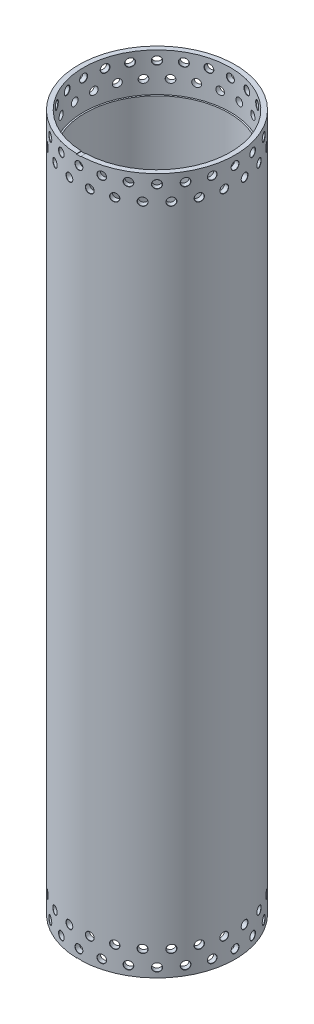
from build123d import *
from build123d.topology import SkipClean

# Parameters (mm, degrees)
SZKIC1_R                    = 90
SZKIC1_R_2                  = 80
DODANIE_WYCI_GNI_CIE1_DEPTH = 775
SZKIC2_R                    = 90
SZKIC2_R_2                  = 87
WYTNIJ_WYCI_GNI_CIE1_DEPTH  = 786.382072625
WYTNIJ_WYCI_GNI_CIE2_START  = -43
SZKIC3_R                    = 81.7
SZKIC3_R_2                  = 80
WYTNIJ_WYCI_GNI_CIE2_DEPTH  = 43
WYTNIJ_WYCI_GNI_CIE3_DEPTH  = 0.5
SZYK_KO_OWY1_COUNT          = 24


with BuildPart() as part:
    # Szkic1 → Dodanie-wyciągnięcie1 (new body)
    with BuildSketch(Plane(origin=(0, 0, 0), x_dir=(1, 0, 0), z_dir=(0, 1, 0))):
        with Locations(Location((0, 0, 0), (0, 0, 270))):
            Circle(SZKIC1_R)
        with Locations(Location((0, 0, 0), (0, 0, 270))):
            Circle(SZKIC1_R_2, mode=Mode.SUBTRACT)
    extrude(amount=DODANIE_WYCI_GNI_CIE1_DEPTH)

    # Szkic2 → Wytnij-wyciągnięcie1 (cut, through all)
    with BuildSketch(Plane(origin=(0, 775, 0), x_dir=(1, 0, 0), z_dir=(0, 1, 0))):
        Circle(SZKIC2_R)
        with Locations(Location((0, 0, 0), (0, 0, 270))):
            Circle(SZKIC2_R_2, mode=Mode.SUBTRACT)
    extrude(amount=-WYTNIJ_WYCI_GNI_CIE1_DEPTH, mode=Mode.SUBTRACT)

    # Szkic3 → Wytnij-wyciągnięcie2 (cut)
    with BuildSketch(Plane(origin=(0, 775, 0), x_dir=(1, 0, 0), z_dir=(0, 1, 0)).offset(WYTNIJ_WYCI_GNI_CIE2_START)):
        with Locations(Location((0, 0, 0), (0, 0, 270))):
            Circle(SZKIC3_R)
        with Locations(Location((0, 0, 0), (0, 0, 270))):
            Circle(SZKIC3_R_2, mode=Mode.SUBTRACT)
    wytnij_wyci_gni_cie2 = extrude(amount=WYTNIJ_WYCI_GNI_CIE2_DEPTH, mode=Mode.SUBTRACT)

    # Otwór Ø8.5 (8.5)1: read off the stored shape, not the designer's step
    # Otwór Ø8.5 (8.5)1 outline → Otwór Ø8.5 (8.5)1 (revolve, cut)
    with BuildSketch(Plane.XZ.offset(-764.8)):
        Polygon((4.25, 81.575923722), (4.500000084, 81.575923722), (4.5, 81.7), (4.25, 81.95), align=None)
        Polygon((0, 81.575923722), (4.25, 81.575923722), (4.25, 81.95), (4.25, 86.75), (4.25, 87.000000084), (0, 87.000000084), align=None)
        Polygon((4.25, 86.75), (4.500000084, 87.000000084), (4.25, 87.000000084), align=None)
    otw_r_8_5_8_5_1 = revolve(axis=Axis((0, 764.8, 0), (0, 0, 1)), mode=Mode.SUBTRACT)

    # Otwór Ø8.5 (8.5)2: read off the stored shape, not the designer's step
    # Otwór Ø8.5 (8.5)2 outline → Otwór Ø8.5 (8.5)2 (revolve, cut)
    with BuildSketch(Plane(origin=(0, 747.5, 0), x_dir=(0.9914448613738103, 0, -0.13052619222005205), z_dir=(0, -1, 0))):
        Polygon((0, 81.589323977), (4.25, 81.589323977), (4.25, 86.75), (4.500063259, 87.000063259), (0, 87.000063259), align=None)
    otw_r_8_5_8_5_2 = revolve(axis=Axis((0, 747.5, 0), (0.13052619222005205, 0, 0.9914448613738103)), mode=Mode.SUBTRACT)

    # Szkic9 → Wytnij-wyciągnięcie3 (cut)
    with BuildSketch(Plane(origin=(0, 775, 0), x_dir=(1, 0, 0), z_dir=(0, 1, 0))):
        with BuildLine():
            Line((0, -81.7), (0, -87))
            ThreePointArc((0, -87), (1.250129068, -86.991017797), (2.5, -86.964073042))
            Line((2.5, -86.964073042), (2.5, -81.661741348))
            ThreePointArc((2.5, -81.661741348), (1.250146364, -81.690434777), (0, -81.7))
        make_face()
        with BuildLine():
            ThreePointArc((-2.5, -86.964073042), (-1.250129068, -86.991017797), (0, -87))
            Line((0, -87), (0, -81.7))
            ThreePointArc((0, -81.7), (-1.250146364, -81.690434777), (-2.5, -81.661741348))
            Line((-2.5, -81.661741348), (-2.5, -86.964073042))
        make_face()
    wytnij_wyci_gni_cie3 = extrude(amount=-WYTNIJ_WYCI_GNI_CIE3_DEPTH, mode=Mode.SUBTRACT)

    # Szyk kołowy1: Otwór Ø8.5 (8.5)1, Otwór Ø8.5 (8.5)2 ×24 about axis
    with SkipClean():  # the faces are left unmerged after this step: merging them gives an invalid solid
        szyk_ko_owy1_axis = Axis((0, 0, 0), (0, 1, 0))
        add([otw_r_8_5_8_5_1.rotate(szyk_ko_owy1_axis, i * 360 / SZYK_KO_OWY1_COUNT) for i in range(1, SZYK_KO_OWY1_COUNT)], mode=Mode.SUBTRACT)
        add([otw_r_8_5_8_5_2.rotate(szyk_ko_owy1_axis, i * 360 / SZYK_KO_OWY1_COUNT) for i in range(1, SZYK_KO_OWY1_COUNT)], mode=Mode.SUBTRACT)

    # Lustro1: Wytnij-wyciągnięcie2, Otwór Ø8.5 (8.5)1, Otwór Ø8.5 (8.5)2, Wytnij-wyciągnięcie3 across plane
    with SkipClean():  # the faces are left unmerged after this step: merging them gives an invalid solid
        add(wytnij_wyci_gni_cie2.mirror(Plane.ZX.offset(387.5)), mode=Mode.SUBTRACT)
        add(otw_r_8_5_8_5_1.mirror(Plane.ZX.offset(387.5)), mode=Mode.SUBTRACT)
        add(otw_r_8_5_8_5_2.mirror(Plane.ZX.offset(387.5)), mode=Mode.SUBTRACT)
        add(wytnij_wyci_gni_cie3.mirror(Plane.ZX.offset(387.5)), mode=Mode.SUBTRACT)

    # Lustro1 copy 1 sketch → Lustro1 copy 1 (revolve, cut)
    with SkipClean():  # the faces are left unmerged after this step: merging them gives an invalid solid
        with BuildSketch(Plane(origin=(0, 10.2, 0), x_dir=(0.9659258262890683, 0, -0.25881904510252074), z_dir=(0, 1, 0))):
            Polygon((4.25, -81.575923722), (4.500000084, -81.575923722), (4.5, -81.7), (4.25, -81.95), align=None)
            Polygon((0, -81.575923722), (4.25, -81.575923722), (4.25, -81.95), (4.25, -86.75), (4.25, -87.000000084), (0, -87.000000084), align=None)
            Polygon((4.25, -86.75), (4.500000084, -87.000000084), (4.25, -87.000000084), align=None)
        revolve(axis=Axis((0, 10.2, 0), (-0.25881904510252074, 0, -0.9659258262890683)), mode=Mode.SUBTRACT)

    # Lustro1 copy 2 sketch → Lustro1 copy 2 (revolve, cut)
    with SkipClean():  # the faces are left unmerged after this step: merging them gives an invalid solid
        with BuildSketch(Plane(origin=(0, 10.2, 0), x_dir=(0.8660254037844387, 0, -0.49999999999999994), z_dir=(0, 1, 0))):
            Polygon((4.25, -81.575923722), (4.500000084, -81.575923722), (4.5, -81.7), (4.25, -81.95), align=None)
            Polygon((0, -81.575923722), (4.25, -81.575923722), (4.25, -81.95), (4.25, -86.75), (4.25, -87.000000084), (0, -87.000000084), align=None)
            Polygon((4.25, -86.75), (4.500000084, -87.000000084), (4.25, -87.000000084), align=None)
        revolve(axis=Axis((0, 10.2, 0), (-0.49999999999999994, 0, -0.8660254037844387)), mode=Mode.SUBTRACT)

    # Lustro1 copy 3 sketch → Lustro1 copy 3 (revolve, cut)
    with SkipClean():  # the faces are left unmerged after this step: merging them gives an invalid solid
        with BuildSketch(Plane(origin=(0, 10.2, 0), x_dir=(0.7071067811865476, 0, -0.7071067811865475), z_dir=(0, 1, 0))):
            Polygon((4.25, -81.575923722), (4.500000084, -81.575923722), (4.5, -81.7), (4.25, -81.95), align=None)
            Polygon((0, -81.575923722), (4.25, -81.575923722), (4.25, -81.95), (4.25, -86.75), (4.25, -87.000000084), (0, -87.000000084), align=None)
            Polygon((4.25, -86.75), (4.500000084, -87.000000084), (4.25, -87.000000084), align=None)
        revolve(axis=Axis((0, 10.2, 0), (-0.7071067811865475, 0, -0.7071067811865476)), mode=Mode.SUBTRACT)

    # Lustro1 copy 4 sketch → Lustro1 copy 4 (revolve, cut)
    with SkipClean():  # the faces are left unmerged after this step: merging them gives an invalid solid
        with BuildSketch(Plane(origin=(0, 10.2, 0), x_dir=(0.5000000000000001, 0, -0.8660254037844386), z_dir=(0, 1, 0))):
            Polygon((4.25, -81.575923722), (4.500000084, -81.575923722), (4.5, -81.7), (4.25, -81.95), align=None)
            Polygon((0, -81.575923722), (4.25, -81.575923722), (4.25, -81.95), (4.25, -86.75), (4.25, -87.000000084), (0, -87.000000084), align=None)
            Polygon((4.25, -86.75), (4.500000084, -87.000000084), (4.25, -87.000000084), align=None)
        revolve(axis=Axis((0, 10.2, 0), (-0.8660254037844386, 0, -0.5000000000000001)), mode=Mode.SUBTRACT)

    # Lustro1 copy 5 sketch → Lustro1 copy 5 (revolve, cut)
    with SkipClean():  # the faces are left unmerged after this step: merging them gives an invalid solid
        with BuildSketch(Plane(origin=(0, 10.2, 0), x_dir=(0.25881904510252074, 0, -0.9659258262890683), z_dir=(0, 1, 0))):
            Polygon((4.25, -81.575923722), (4.500000084, -81.575923722), (4.5, -81.7), (4.25, -81.95), align=None)
            Polygon((0, -81.575923722), (4.25, -81.575923722), (4.25, -81.95), (4.25, -86.75), (4.25, -87.000000084), (0, -87.000000084), align=None)
            Polygon((4.25, -86.75), (4.500000084, -87.000000084), (4.25, -87.000000084), align=None)
        revolve(axis=Axis((0, 10.2, 0), (-0.9659258262890683, 0, -0.25881904510252074)), mode=Mode.SUBTRACT)

    # Lustro1 copy 6 sketch → Lustro1 copy 6 (revolve, cut)
    with SkipClean():  # the faces are left unmerged after this step: merging them gives an invalid solid
        with BuildSketch(Plane(origin=(0, 10.2, 0), x_dir=(0, 0, -1), z_dir=(0, 1, 0))):
            Polygon((4.25, -81.575923722), (4.500000084, -81.575923722), (4.5, -81.7), (4.25, -81.95), align=None)
            Polygon((0, -81.575923722), (4.25, -81.575923722), (4.25, -81.95), (4.25, -86.75), (4.25, -87.000000084), (0, -87.000000084), align=None)
            Polygon((4.25, -86.75), (4.500000084, -87.000000084), (4.25, -87.000000084), align=None)
        revolve(axis=Axis((0, 10.2, 0), (-1, 0, 0)), mode=Mode.SUBTRACT)

    # Lustro1 copy 7 sketch → Lustro1 copy 7 (revolve, cut)
    with SkipClean():  # the faces are left unmerged after this step: merging them gives an invalid solid
        with BuildSketch(Plane(origin=(0, 10.2, 0), x_dir=(-0.25881904510252085, 0, -0.9659258262890683), z_dir=(0, 1, 0))):
            Polygon((4.25, -81.575923722), (4.500000084, -81.575923722), (4.5, -81.7), (4.25, -81.95), align=None)
            Polygon((0, -81.575923722), (4.25, -81.575923722), (4.25, -81.95), (4.25, -86.75), (4.25, -87.000000084), (0, -87.000000084), align=None)
            Polygon((4.25, -86.75), (4.500000084, -87.000000084), (4.25, -87.000000084), align=None)
        revolve(axis=Axis((0, 10.2, 0), (-0.9659258262890683, 0, 0.25881904510252085)), mode=Mode.SUBTRACT)

    # Lustro1 copy 8 sketch → Lustro1 copy 8 (revolve, cut)
    with SkipClean():  # the faces are left unmerged after this step: merging them gives an invalid solid
        with BuildSketch(Plane(origin=(0, 10.2, 0), x_dir=(-0.4999999999999998, 0, -0.8660254037844387), z_dir=(0, 1, 0))):
            Polygon((4.25, -81.575923722), (4.500000084, -81.575923722), (4.5, -81.7), (4.25, -81.95), align=None)
            Polygon((0, -81.575923722), (4.25, -81.575923722), (4.25, -81.95), (4.25, -86.75), (4.25, -87.000000084), (0, -87.000000084), align=None)
            Polygon((4.25, -86.75), (4.500000084, -87.000000084), (4.25, -87.000000084), align=None)
        revolve(axis=Axis((0, 10.2, 0), (-0.8660254037844387, 0, 0.4999999999999998)), mode=Mode.SUBTRACT)

    # Lustro1 copy 9 sketch → Lustro1 copy 9 (revolve, cut)
    with SkipClean():  # the faces are left unmerged after this step: merging them gives an invalid solid
        with BuildSketch(Plane(origin=(0, 10.2, 0), x_dir=(-0.7071067811865475, 0, -0.7071067811865476), z_dir=(0, 1, 0))):
            Polygon((4.25, -81.575923722), (4.500000084, -81.575923722), (4.5, -81.7), (4.25, -81.95), align=None)
            Polygon((0, -81.575923722), (4.25, -81.575923722), (4.25, -81.95), (4.25, -86.75), (4.25, -87.000000084), (0, -87.000000084), align=None)
            Polygon((4.25, -86.75), (4.500000084, -87.000000084), (4.25, -87.000000084), align=None)
        revolve(axis=Axis((0, 10.2, 0), (-0.7071067811865476, 0, 0.7071067811865475)), mode=Mode.SUBTRACT)

    # Lustro1 copy 10 sketch → Lustro1 copy 10 (revolve, cut)
    with SkipClean():  # the faces are left unmerged after this step: merging them gives an invalid solid
        with BuildSketch(Plane(origin=(0, 10.2, 0), x_dir=(-0.8660254037844387, 0, -0.49999999999999994), z_dir=(0, 1, 0))):
            Polygon((4.25, -81.575923722), (4.500000084, -81.575923722), (4.5, -81.7), (4.25, -81.95), align=None)
            Polygon((0, -81.575923722), (4.25, -81.575923722), (4.25, -81.95), (4.25, -86.75), (4.25, -87.000000084), (0, -87.000000084), align=None)
            Polygon((4.25, -86.75), (4.500000084, -87.000000084), (4.25, -87.000000084), align=None)
        revolve(axis=Axis((0, 10.2, 0), (-0.49999999999999994, 0, 0.8660254037844387)), mode=Mode.SUBTRACT)

    # Lustro1 copy 11 sketch → Lustro1 copy 11 (revolve, cut)
    with SkipClean():  # the faces are left unmerged after this step: merging them gives an invalid solid
        with BuildSketch(Plane(origin=(0, 10.2, 0), x_dir=(-0.9659258262890682, 0, -0.258819045102521), z_dir=(0, 1, 0))):
            Polygon((4.25, -81.575923722), (4.500000084, -81.575923722), (4.5, -81.7), (4.25, -81.95), align=None)
            Polygon((0, -81.575923722), (4.25, -81.575923722), (4.25, -81.95), (4.25, -86.75), (4.25, -87.000000084), (0, -87.000000084), align=None)
            Polygon((4.25, -86.75), (4.500000084, -87.000000084), (4.25, -87.000000084), align=None)
        revolve(axis=Axis((0, 10.2, 0), (-0.258819045102521, 0, 0.9659258262890682)), mode=Mode.SUBTRACT)

    # Lustro1 copy 12 sketch → Lustro1 copy 12 (revolve, cut)
    with SkipClean():  # the faces are left unmerged after this step: merging them gives an invalid solid
        with BuildSketch(Plane(origin=(0, 10.2, 0), x_dir=(-1, 0, 0), z_dir=(0, 1, 0))):
            Polygon((4.25, -81.575923722), (4.500000084, -81.575923722), (4.5, -81.7), (4.25, -81.95), align=None)
            Polygon((0, -81.575923722), (4.25, -81.575923722), (4.25, -81.95), (4.25, -86.75), (4.25, -87.000000084), (0, -87.000000084), align=None)
            Polygon((4.25, -86.75), (4.500000084, -87.000000084), (4.25, -87.000000084), align=None)
        revolve(axis=Axis((0, 10.2, 0), (0, 0, 1)), mode=Mode.SUBTRACT)

    # Lustro1 copy 13 sketch → Lustro1 copy 13 (revolve, cut)
    with SkipClean():  # the faces are left unmerged after this step: merging them gives an invalid solid
        with BuildSketch(Plane(origin=(0, 10.2, 0), x_dir=(-0.9659258262890683, 0, 0.2588190451025208), z_dir=(0, 1, 0))):
            Polygon((4.25, -81.575923722), (4.500000084, -81.575923722), (4.5, -81.7), (4.25, -81.95), align=None)
            Polygon((0, -81.575923722), (4.25, -81.575923722), (4.25, -81.95), (4.25, -86.75), (4.25, -87.000000084), (0, -87.000000084), align=None)
            Polygon((4.25, -86.75), (4.500000084, -87.000000084), (4.25, -87.000000084), align=None)
        revolve(axis=Axis((0, 10.2, 0), (0.2588190451025208, 0, 0.9659258262890683)), mode=Mode.SUBTRACT)

    # Lustro1 copy 14 sketch → Lustro1 copy 14 (revolve, cut)
    with SkipClean():  # the faces are left unmerged after this step: merging them gives an invalid solid
        with BuildSketch(Plane(origin=(0, 10.2, 0), x_dir=(-0.8660254037844386, 0, 0.5000000000000001), z_dir=(0, 1, 0))):
            Polygon((4.25, -81.575923722), (4.500000084, -81.575923722), (4.5, -81.7), (4.25, -81.95), align=None)
            Polygon((0, -81.575923722), (4.25, -81.575923722), (4.25, -81.95), (4.25, -86.75), (4.25, -87.000000084), (0, -87.000000084), align=None)
            Polygon((4.25, -86.75), (4.500000084, -87.000000084), (4.25, -87.000000084), align=None)
        revolve(axis=Axis((0, 10.2, 0), (0.5000000000000001, 0, 0.8660254037844386)), mode=Mode.SUBTRACT)

    # Lustro1 copy 15 sketch → Lustro1 copy 15 (revolve, cut)
    with SkipClean():  # the faces are left unmerged after this step: merging them gives an invalid solid
        with BuildSketch(Plane(origin=(0, 10.2, 0), x_dir=(-0.7071067811865477, 0, 0.7071067811865475), z_dir=(0, 1, 0))):
            Polygon((4.25, -81.575923722), (4.500000084, -81.575923722), (4.5, -81.7), (4.25, -81.95), align=None)
            Polygon((0, -81.575923722), (4.25, -81.575923722), (4.25, -81.95), (4.25, -86.75), (4.25, -87.000000084), (0, -87.000000084), align=None)
            Polygon((4.25, -86.75), (4.500000084, -87.000000084), (4.25, -87.000000084), align=None)
        revolve(axis=Axis((0, 10.2, 0), (0.7071067811865475, 0, 0.7071067811865477)), mode=Mode.SUBTRACT)

    # Lustro1 copy 16 sketch → Lustro1 copy 16 (revolve, cut)
    with SkipClean():  # the faces are left unmerged after this step: merging them gives an invalid solid
        with BuildSketch(Plane(origin=(0, 10.2, 0), x_dir=(-0.5000000000000004, 0, 0.8660254037844384), z_dir=(0, 1, 0))):
            Polygon((4.25, -81.575923722), (4.500000084, -81.575923722), (4.5, -81.7), (4.25, -81.95), align=None)
            Polygon((0, -81.575923722), (4.25, -81.575923722), (4.25, -81.95), (4.25, -86.75), (4.25, -87.000000084), (0, -87.000000084), align=None)
            Polygon((4.25, -86.75), (4.500000084, -87.000000084), (4.25, -87.000000084), align=None)
        revolve(axis=Axis((0, 10.2, 0), (0.8660254037844384, 0, 0.5000000000000004)), mode=Mode.SUBTRACT)

    # Lustro1 copy 17 sketch → Lustro1 copy 17 (revolve, cut)
    with SkipClean():  # the faces are left unmerged after this step: merging them gives an invalid solid
        with BuildSketch(Plane(origin=(0, 10.2, 0), x_dir=(-0.25881904510252063, 0, 0.9659258262890683), z_dir=(0, 1, 0))):
            Polygon((4.25, -81.575923722), (4.500000084, -81.575923722), (4.5, -81.7), (4.25, -81.95), align=None)
            Polygon((0, -81.575923722), (4.25, -81.575923722), (4.25, -81.95), (4.25, -86.75), (4.25, -87.000000084), (0, -87.000000084), align=None)
            Polygon((4.25, -86.75), (4.500000084, -87.000000084), (4.25, -87.000000084), align=None)
        revolve(axis=Axis((0, 10.2, 0), (0.9659258262890683, 0, 0.25881904510252063)), mode=Mode.SUBTRACT)

    # Lustro1 copy 18 sketch → Lustro1 copy 18 (revolve, cut)
    with SkipClean():  # the faces are left unmerged after this step: merging them gives an invalid solid
        with BuildSketch(Plane.ZX.offset(10.2)):
            Polygon((4.25, -81.575923722), (4.500000084, -81.575923722), (4.5, -81.7), (4.25, -81.95), align=None)
            Polygon((0, -81.575923722), (4.25, -81.575923722), (4.25, -81.95), (4.25, -86.75), (4.25, -87.000000084), (0, -87.000000084), align=None)
            Polygon((4.25, -86.75), (4.500000084, -87.000000084), (4.25, -87.000000084), align=None)
        revolve(axis=Axis((0, 10.2, 0), (1, 0, 0)), mode=Mode.SUBTRACT)

    # Lustro1 copy 19 sketch → Lustro1 copy 19 (revolve, cut)
    with SkipClean():  # the faces are left unmerged after this step: merging them gives an invalid solid
        with BuildSketch(Plane(origin=(0, 10.2, 0), x_dir=(0.2588190451025203, 0, 0.9659258262890684), z_dir=(0, 1, 0))):
            Polygon((4.25, -81.575923722), (4.500000084, -81.575923722), (4.5, -81.7), (4.25, -81.95), align=None)
            Polygon((0, -81.575923722), (4.25, -81.575923722), (4.25, -81.95), (4.25, -86.75), (4.25, -87.000000084), (0, -87.000000084), align=None)
            Polygon((4.25, -86.75), (4.500000084, -87.000000084), (4.25, -87.000000084), align=None)
        revolve(axis=Axis((0, 10.2, 0), (0.9659258262890684, 0, -0.2588190451025203)), mode=Mode.SUBTRACT)

    # Lustro1 copy 20 sketch → Lustro1 copy 20 (revolve, cut)
    with SkipClean():  # the faces are left unmerged after this step: merging them gives an invalid solid
        with BuildSketch(Plane(origin=(0, 10.2, 0), x_dir=(0.5000000000000001, 0, 0.8660254037844386), z_dir=(0, 1, 0))):
            Polygon((4.25, -81.575923722), (4.500000084, -81.575923722), (4.5, -81.7), (4.25, -81.95), align=None)
            Polygon((0, -81.575923722), (4.25, -81.575923722), (4.25, -81.95), (4.25, -86.75), (4.25, -87.000000084), (0, -87.000000084), align=None)
            Polygon((4.25, -86.75), (4.500000084, -87.000000084), (4.25, -87.000000084), align=None)
        revolve(axis=Axis((0, 10.2, 0), (0.8660254037844386, 0, -0.5000000000000001)), mode=Mode.SUBTRACT)

    # Lustro1 copy 21 sketch → Lustro1 copy 21 (revolve, cut)
    with SkipClean():  # the faces are left unmerged after this step: merging them gives an invalid solid
        with BuildSketch(Plane(origin=(0, 10.2, 0), x_dir=(0.7071067811865474, 0, 0.7071067811865477), z_dir=(0, 1, 0))):
            Polygon((4.25, -81.575923722), (4.500000084, -81.575923722), (4.5, -81.7), (4.25, -81.95), align=None)
            Polygon((0, -81.575923722), (4.25, -81.575923722), (4.25, -81.95), (4.25, -86.75), (4.25, -87.000000084), (0, -87.000000084), align=None)
            Polygon((4.25, -86.75), (4.500000084, -87.000000084), (4.25, -87.000000084), align=None)
        revolve(axis=Axis((0, 10.2, 0), (0.7071067811865477, 0, -0.7071067811865474)), mode=Mode.SUBTRACT)

    # Lustro1 copy 22 sketch → Lustro1 copy 22 (revolve, cut)
    with SkipClean():  # the faces are left unmerged after this step: merging them gives an invalid solid
        with BuildSketch(Plane(origin=(0, 10.2, 0), x_dir=(0.8660254037844384, 0, 0.5000000000000004), z_dir=(0, 1, 0))):
            Polygon((4.25, -81.575923722), (4.500000084, -81.575923722), (4.5, -81.7), (4.25, -81.95), align=None)
            Polygon((0, -81.575923722), (4.25, -81.575923722), (4.25, -81.95), (4.25, -86.75), (4.25, -87.000000084), (0, -87.000000084), align=None)
            Polygon((4.25, -86.75), (4.500000084, -87.000000084), (4.25, -87.000000084), align=None)
        revolve(axis=Axis((0, 10.2, 0), (0.5000000000000004, 0, -0.8660254037844384)), mode=Mode.SUBTRACT)

    # Lustro1 copy 23 sketch → Lustro1 copy 23 (revolve, cut)
    with SkipClean():  # the faces are left unmerged after this step: merging them gives an invalid solid
        with BuildSketch(Plane(origin=(0, 10.2, 0), x_dir=(0.9659258262890683, 0, 0.2588190451025207), z_dir=(0, 1, 0))):
            Polygon((4.25, -81.575923722), (4.500000084, -81.575923722), (4.5, -81.7), (4.25, -81.95), align=None)
            Polygon((0, -81.575923722), (4.25, -81.575923722), (4.25, -81.95), (4.25, -86.75), (4.25, -87.000000084), (0, -87.000000084), align=None)
            Polygon((4.25, -86.75), (4.500000084, -87.000000084), (4.25, -87.000000084), align=None)
        revolve(axis=Axis((0, 10.2, 0), (0.2588190451025207, 0, -0.9659258262890683)), mode=Mode.SUBTRACT)

    # Lustro1 copy 24 sketch → Lustro1 copy 24 (revolve, cut)
    with SkipClean():  # the faces are left unmerged after this step: merging them gives an invalid solid
        with BuildSketch(Plane(origin=(0, 27.5, 0), x_dir=(0.9238795325112865, 0, -0.38268343236509017), z_dir=(0, 1, 0))):
            Polygon((0, -81.589323977), (4.25, -81.589323977), (4.25, -86.75), (4.500063259, -87.000063259), (0, -87.000063259), align=None)
        revolve(axis=Axis((0, 27.5, 0), (-0.38268343236509017, 0, -0.9238795325112865)), mode=Mode.SUBTRACT)

    # Lustro1 copy 25 sketch → Lustro1 copy 25 (revolve, cut)
    with SkipClean():  # the faces are left unmerged after this step: merging them gives an invalid solid
        with BuildSketch(Plane(origin=(0, 27.5, 0), x_dir=(0.7933533402912349, 0, -0.6087614290087209), z_dir=(0, 1, 0))):
            Polygon((0, -81.589323977), (4.25, -81.589323977), (4.25, -86.75), (4.500063259, -87.000063259), (0, -87.000063259), align=None)
        revolve(axis=Axis((0, 27.5, 0), (-0.6087614290087209, 0, -0.7933533402912349)), mode=Mode.SUBTRACT)

    # Lustro1 copy 26 sketch → Lustro1 copy 26 (revolve, cut)
    with SkipClean():  # the faces are left unmerged after this step: merging them gives an invalid solid
        with BuildSketch(Plane(origin=(0, 27.5, 0), x_dir=(0.6087614290087202, 0, -0.7933533402912353), z_dir=(0, 1, 0))):
            Polygon((0, -81.589323977), (4.25, -81.589323977), (4.25, -86.75), (4.500063259, -87.000063259), (0, -87.000063259), align=None)
        revolve(axis=Axis((0, 27.5, 0), (-0.7933533402912353, 0, -0.6087614290087202)), mode=Mode.SUBTRACT)

    # Lustro1 copy 27 sketch → Lustro1 copy 27 (revolve, cut)
    with SkipClean():  # the faces are left unmerged after this step: merging them gives an invalid solid
        with BuildSketch(Plane(origin=(0, 27.5, 0), x_dir=(0.3826834323650894, 0, -0.9238795325112868), z_dir=(0, 1, 0))):
            Polygon((0, -81.589323977), (4.25, -81.589323977), (4.25, -86.75), (4.500063259, -87.000063259), (0, -87.000063259), align=None)
        revolve(axis=Axis((0, 27.5, 0), (-0.9238795325112868, 0, -0.3826834323650894)), mode=Mode.SUBTRACT)

    # Lustro1 copy 28 sketch → Lustro1 copy 28 (revolve, cut)
    with SkipClean():  # the faces are left unmerged after this step: merging them gives an invalid solid
        with BuildSketch(Plane(origin=(0, 27.5, 0), x_dir=(0.13052619222005113, 0, -0.9914448613738105), z_dir=(0, 1, 0))):
            Polygon((0, -81.589323977), (4.25, -81.589323977), (4.25, -86.75), (4.500063259, -87.000063259), (0, -87.000063259), align=None)
        revolve(axis=Axis((0, 27.5, 0), (-0.9914448613738105, 0, -0.13052619222005113)), mode=Mode.SUBTRACT)

    # Lustro1 copy 29 sketch → Lustro1 copy 29 (revolve, cut)
    with SkipClean():  # the faces are left unmerged after this step: merging them gives an invalid solid
        with BuildSketch(Plane(origin=(0, 27.5, 0), x_dir=(-0.130526192220052, 0, -0.9914448613738103), z_dir=(0, 1, 0))):
            Polygon((0, -81.589323977), (4.25, -81.589323977), (4.25, -86.75), (4.500063259, -87.000063259), (0, -87.000063259), align=None)
        revolve(axis=Axis((0, 27.5, 0), (-0.9914448613738103, 0, 0.130526192220052)), mode=Mode.SUBTRACT)

    # Lustro1 copy 30 sketch → Lustro1 copy 30 (revolve, cut)
    with SkipClean():  # the faces are left unmerged after this step: merging them gives an invalid solid
        with BuildSketch(Plane(origin=(0, 27.5, 0), x_dir=(-0.3826834323650902, 0, -0.9238795325112865), z_dir=(0, 1, 0))):
            Polygon((0, -81.589323977), (4.25, -81.589323977), (4.25, -86.75), (4.500063259, -87.000063259), (0, -87.000063259), align=None)
        revolve(axis=Axis((0, 27.5, 0), (-0.9238795325112865, 0, 0.3826834323650902)), mode=Mode.SUBTRACT)

    # Lustro1 copy 31 sketch → Lustro1 copy 31 (revolve, cut)
    with SkipClean():  # the faces are left unmerged after this step: merging them gives an invalid solid
        with BuildSketch(Plane(origin=(0, 27.5, 0), x_dir=(-0.6087614290087208, 0, -0.7933533402912349), z_dir=(0, 1, 0))):
            Polygon((0, -81.589323977), (4.25, -81.589323977), (4.25, -86.75), (4.500063259, -87.000063259), (0, -87.000063259), align=None)
        revolve(axis=Axis((0, 27.5, 0), (-0.7933533402912349, 0, 0.6087614290087208)), mode=Mode.SUBTRACT)

    # Lustro1 copy 32 sketch → Lustro1 copy 32 (revolve, cut)
    with SkipClean():  # the faces are left unmerged after this step: merging them gives an invalid solid
        with BuildSketch(Plane(origin=(0, 27.5, 0), x_dir=(-0.7933533402912353, 0, -0.6087614290087202), z_dir=(0, 1, 0))):
            Polygon((0, -81.589323977), (4.25, -81.589323977), (4.25, -86.75), (4.500063259, -87.000063259), (0, -87.000063259), align=None)
        revolve(axis=Axis((0, 27.5, 0), (-0.6087614290087202, 0, 0.7933533402912353)), mode=Mode.SUBTRACT)

    # Lustro1 copy 33 sketch → Lustro1 copy 33 (revolve, cut)
    with SkipClean():  # the faces are left unmerged after this step: merging them gives an invalid solid
        with BuildSketch(Plane(origin=(0, 27.5, 0), x_dir=(-0.923879532511287, 0, -0.3826834323650892), z_dir=(0, 1, 0))):
            Polygon((0, -81.589323977), (4.25, -81.589323977), (4.25, -86.75), (4.500063259, -87.000063259), (0, -87.000063259), align=None)
        revolve(axis=Axis((0, 27.5, 0), (-0.3826834323650892, 0, 0.923879532511287)), mode=Mode.SUBTRACT)

    # Lustro1 copy 34 sketch → Lustro1 copy 34 (revolve, cut)
    with SkipClean():  # the faces are left unmerged after this step: merging them gives an invalid solid
        with BuildSketch(Plane(origin=(0, 27.5, 0), x_dir=(-0.9914448613738104, 0, -0.13052619222005135), z_dir=(0, 1, 0))):
            Polygon((0, -81.589323977), (4.25, -81.589323977), (4.25, -86.75), (4.500063259, -87.000063259), (0, -87.000063259), align=None)
        revolve(axis=Axis((0, 27.5, 0), (-0.13052619222005135, 0, 0.9914448613738104)), mode=Mode.SUBTRACT)

    # Lustro1 copy 35 sketch → Lustro1 copy 35 (revolve, cut)
    with SkipClean():  # the faces are left unmerged after this step: merging them gives an invalid solid
        with BuildSketch(Plane(origin=(0, 27.5, 0), x_dir=(-0.9914448613738103, 0, 0.13052619222005193), z_dir=(0, 1, 0))):
            Polygon((0, -81.589323977), (4.25, -81.589323977), (4.25, -86.75), (4.500063259, -87.000063259), (0, -87.000063259), align=None)
        revolve(axis=Axis((0, 27.5, 0), (0.13052619222005193, 0, 0.9914448613738103)), mode=Mode.SUBTRACT)

    # Lustro1 copy 36 sketch → Lustro1 copy 36 (revolve, cut)
    with SkipClean():  # the faces are left unmerged after this step: merging them gives an invalid solid
        with BuildSketch(Plane(origin=(0, 27.5, 0), x_dir=(-0.9238795325112865, 0, 0.3826834323650902), z_dir=(0, 1, 0))):
            Polygon((0, -81.589323977), (4.25, -81.589323977), (4.25, -86.75), (4.500063259, -87.000063259), (0, -87.000063259), align=None)
        revolve(axis=Axis((0, 27.5, 0), (0.3826834323650902, 0, 0.9238795325112865)), mode=Mode.SUBTRACT)

    # Lustro1 copy 37 sketch → Lustro1 copy 37 (revolve, cut)
    with SkipClean():  # the faces are left unmerged after this step: merging them gives an invalid solid
        with BuildSketch(Plane(origin=(0, 27.5, 0), x_dir=(-0.7933533402912348, 0, 0.6087614290087211), z_dir=(0, 1, 0))):
            Polygon((0, -81.589323977), (4.25, -81.589323977), (4.25, -86.75), (4.500063259, -87.000063259), (0, -87.000063259), align=None)
        revolve(axis=Axis((0, 27.5, 0), (0.6087614290087211, 0, 0.7933533402912348)), mode=Mode.SUBTRACT)

    # Lustro1 copy 38 sketch → Lustro1 copy 38 (revolve, cut)
    with SkipClean():  # the faces are left unmerged after this step: merging them gives an invalid solid
        with BuildSketch(Plane(origin=(0, 27.5, 0), x_dir=(-0.6087614290087203, 0, 0.7933533402912353), z_dir=(0, 1, 0))):
            Polygon((0, -81.589323977), (4.25, -81.589323977), (4.25, -86.75), (4.500063259, -87.000063259), (0, -87.000063259), align=None)
        revolve(axis=Axis((0, 27.5, 0), (0.7933533402912353, 0, 0.6087614290087203)), mode=Mode.SUBTRACT)

    # Lustro1 copy 39 sketch → Lustro1 copy 39 (revolve, cut)
    with SkipClean():  # the faces are left unmerged after this step: merging them gives an invalid solid
        with BuildSketch(Plane(origin=(0, 27.5, 0), x_dir=(-0.3826834323650898, 0, 0.9238795325112867), z_dir=(0, 1, 0))):
            Polygon((0, -81.589323977), (4.25, -81.589323977), (4.25, -86.75), (4.500063259, -87.000063259), (0, -87.000063259), align=None)
        revolve(axis=Axis((0, 27.5, 0), (0.9238795325112867, 0, 0.3826834323650898)), mode=Mode.SUBTRACT)

    # Lustro1 copy 40 sketch → Lustro1 copy 40 (revolve, cut)
    with SkipClean():  # the faces are left unmerged after this step: merging them gives an invalid solid
        with BuildSketch(Plane(origin=(0, 27.5, 0), x_dir=(-0.13052619222005102, 0, 0.9914448613738104), z_dir=(0, 1, 0))):
            Polygon((0, -81.589323977), (4.25, -81.589323977), (4.25, -86.75), (4.500063259, -87.000063259), (0, -87.000063259), align=None)
        revolve(axis=Axis((0, 27.5, 0), (0.9914448613738104, 0, 0.13052619222005102)), mode=Mode.SUBTRACT)

    # Lustro1 copy 41 sketch → Lustro1 copy 41 (revolve, cut)
    with SkipClean():  # the faces are left unmerged after this step: merging them gives an invalid solid
        with BuildSketch(Plane(origin=(0, 27.5, 0), x_dir=(0.13052619222005185, 0, 0.9914448613738103), z_dir=(0, 1, 0))):
            Polygon((0, -81.589323977), (4.25, -81.589323977), (4.25, -86.75), (4.500063259, -87.000063259), (0, -87.000063259), align=None)
        revolve(axis=Axis((0, 27.5, 0), (0.9914448613738103, 0, -0.13052619222005185)), mode=Mode.SUBTRACT)

    # Lustro1 copy 42 sketch → Lustro1 copy 42 (revolve, cut)
    with SkipClean():  # the faces are left unmerged after this step: merging them gives an invalid solid
        with BuildSketch(Plane(origin=(0, 27.5, 0), x_dir=(0.3826834323650897, 0, 0.9238795325112867), z_dir=(0, 1, 0))):
            Polygon((0, -81.589323977), (4.25, -81.589323977), (4.25, -86.75), (4.500063259, -87.000063259), (0, -87.000063259), align=None)
        revolve(axis=Axis((0, 27.5, 0), (0.9238795325112867, 0, -0.3826834323650897)), mode=Mode.SUBTRACT)

    # Lustro1 copy 43 sketch → Lustro1 copy 43 (revolve, cut)
    with SkipClean():  # the faces are left unmerged after this step: merging them gives an invalid solid
        with BuildSketch(Plane(origin=(0, 27.5, 0), x_dir=(0.6087614290087211, 0, 0.7933533402912348), z_dir=(0, 1, 0))):
            Polygon((0, -81.589323977), (4.25, -81.589323977), (4.25, -86.75), (4.500063259, -87.000063259), (0, -87.000063259), align=None)
        revolve(axis=Axis((0, 27.5, 0), (0.7933533402912348, 0, -0.6087614290087211)), mode=Mode.SUBTRACT)

    # Lustro1 copy 44 sketch → Lustro1 copy 44 (revolve, cut)
    with SkipClean():  # the faces are left unmerged after this step: merging them gives an invalid solid
        with BuildSketch(Plane(origin=(0, 27.5, 0), x_dir=(0.7933533402912352, 0, 0.6087614290087203), z_dir=(0, 1, 0))):
            Polygon((0, -81.589323977), (4.25, -81.589323977), (4.25, -86.75), (4.500063259, -87.000063259), (0, -87.000063259), align=None)
        revolve(axis=Axis((0, 27.5, 0), (0.6087614290087203, 0, -0.7933533402912352)), mode=Mode.SUBTRACT)

    # Lustro1 copy 45 sketch → Lustro1 copy 45 (revolve, cut)
    with SkipClean():  # the faces are left unmerged after this step: merging them gives an invalid solid
        with BuildSketch(Plane(origin=(0, 27.5, 0), x_dir=(0.9238795325112867, 0, 0.3826834323650898), z_dir=(0, 1, 0))):
            Polygon((0, -81.589323977), (4.25, -81.589323977), (4.25, -86.75), (4.500063259, -87.000063259), (0, -87.000063259), align=None)
        revolve(axis=Axis((0, 27.5, 0), (0.3826834323650898, 0, -0.9238795325112867)), mode=Mode.SUBTRACT)

    # Lustro1 copy 46 sketch → Lustro1 copy 46 (revolve, cut)
    with SkipClean():  # the faces are left unmerged after this step: merging them gives an invalid solid
        with BuildSketch(Plane(origin=(0, 27.5, 0), x_dir=(0.9914448613738105, 0, 0.13052619222005107), z_dir=(0, 1, 0))):
            Polygon((0, -81.589323977), (4.25, -81.589323977), (4.25, -86.75), (4.500063259, -87.000063259), (0, -87.000063259), align=None)
        revolve(axis=Axis((0, 27.5, 0), (0.13052619222005107, 0, -0.9914448613738105)), mode=Mode.SUBTRACT)


solid = part.part
